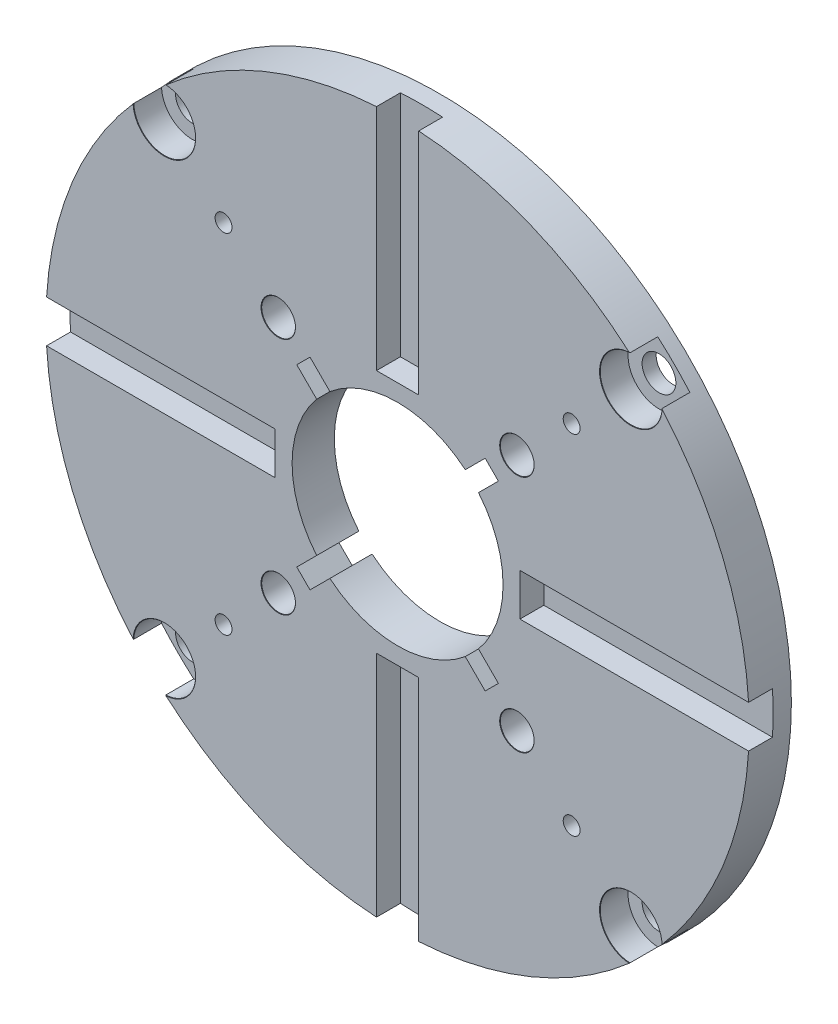
from build123d import *

# Parameters (mm, degrees)
SKETCH1_R             = 0.6
BOSS_EXTRUDE1_DEPTH   = 3
BOSS_EXTRUDE1_2_DEPTH = 3
BOSS_EXTRUDE1_3_DEPTH = 3
BOSS_EXTRUDE1_4_DEPTH = 3
BOSS_EXTRUDE2_DEPTH   = 1.3
BOSS_EXTRUDE3_DEPTH   = 3
CIRPATTERN1_COUNT     = 4


# Read off the part's stored shape, not the designer's step: M2 Clearance Hole1
with BuildPart() as part:
    # Sketch1 → Boss-Extrude1 (new body)
    with BuildSketch(Plane(origin=(0, 0, 0), x_dir=(0, 1, 0), z_dir=(0, 0, 1))):
        with BuildLine():
            Line((-1.5, 7.348469228), (-1.5, 24.954959427))
            ThreePointArc((-1.5, 24.954959427), (-17.67766953, 17.67766953), (-24.954959427, 1.5))
            Line((-24.954959427, 1.5), (-7.348469228, 1.5))
            ThreePointArc((-7.348469228, 1.5), (-6.756656365, 3.255394717), (-5.752639047, 4.812187028))
            Line((-5.752639047, 4.812187028), (-7.166852609, 6.226400591))
            Line((-7.166852609, 6.226400591), (-6.226400591, 7.166852609))
            Line((-6.226400591, 7.166852609), (-4.812187028, 5.752639047))
            ThreePointArc((-4.812187028, 5.752639047), (-3.255394717, 6.756656365), (-1.5, 7.348469228))
        make_face()
        with Locations(Location((-12.375, 12.375, 0), (0, 0, 270))):
            Circle(SKETCH1_R, mode=Mode.SUBTRACT)
    extrude(amount=BOSS_EXTRUDE1_DEPTH)

    # Sketch1<9> → Boss-Extrude2 (add)
    with BuildSketch(Plane(origin=(0, 0, 0), x_dir=(0, 1, 0), z_dir=(0, 0, 1))):
        with BuildLine():
            Line((1.5, 7.348469228), (1.5, 24.954959427))
            ThreePointArc((1.5, 24.954959427), (0, 25), (-1.5, 24.954959427))
            Line((-1.5, 24.954959427), (-1.5, 7.348469228))
            ThreePointArc((-1.5, 7.348469228), (0, 7.5), (1.5, 7.348469228))
        make_face()
        with BuildLine():
            ThreePointArc((-24.954959427, 1.5), (-25, 0), (-24.954959427, -1.5))
            Line((-24.954959427, -1.5), (-7.348469228, -1.5))
            ThreePointArc((-7.348469228, -1.5), (-7.5, 0), (-7.348469228, 1.5))
            Line((-7.348469228, 1.5), (-24.954959427, 1.5))
        make_face()
        with BuildLine():
            ThreePointArc((24.954959427, -1.5), (25, 0), (24.954959427, 1.5))
            Line((24.954959427, 1.5), (7.348469228, 1.5))
            ThreePointArc((7.348469228, 1.5), (7.5, 0), (7.348469228, -1.5))
            Line((7.348469228, -1.5), (24.954959427, -1.5))
        make_face()
        with BuildLine():
            ThreePointArc((-1.5, -24.954959427), (0, -25), (1.5, -24.954959427))
            Line((1.5, -24.954959427), (1.5, -7.348469228))
            ThreePointArc((1.5, -7.348469228), (0, -7.5), (-1.5, -7.348469228))
            Line((-1.5, -7.348469228), (-1.5, -24.954959427))
        make_face()
    extrude(amount=BOSS_EXTRUDE2_DEPTH)


with BuildPart() as body_2:
    # Sketch1 → Boss-Extrude1 2 (new body)
    with BuildSketch(Plane(origin=(0, 0, 0), x_dir=(0, 1, 0), z_dir=(0, 0, 1))):
        with BuildLine():
            Line((1.5, 24.954959427), (1.5, 7.348469228))
            ThreePointArc((1.5, 7.348469228), (3.255394717, 6.756656365), (4.812187028, 5.752639047))
            Line((4.812187028, 5.752639047), (6.226400591, 7.166852609))
            Line((6.226400591, 7.166852609), (7.166852609, 6.226400591))
            Line((7.166852609, 6.226400591), (5.752639047, 4.812187028))
            ThreePointArc((5.752639047, 4.812187028), (6.756656365, 3.255394717), (7.348469228, 1.5))
            Line((7.348469228, 1.5), (24.954959427, 1.5))
            ThreePointArc((24.954959427, 1.5), (17.67766953, 17.67766953), (1.5, 24.954959427))
        make_face()
        with Locations(Location((12.375, 12.375, 0), (0, 0, 270))):
            Circle(SKETCH1_R, mode=Mode.SUBTRACT)
    extrude(amount=BOSS_EXTRUDE1_2_DEPTH)

    # M2 Clearance Hole1 4 outline → M2 Clearance Hole1 4 (revolve, cut)
    with BuildSketch(Plane(origin=(-8.485, 8.485, 0), x_dir=(1, 0, 0), z_dir=(0, -1, 0))):
        Polygon((0, 0), (1.2, 0), (1.2, 2.975), (1.225, 3), (0, 3), align=None)
    revolve(axis=Axis((-8.485, 8.485, 0), (0, 0, 1)), mode=Mode.SUBTRACT)



with BuildPart() as body_3:
    # Sketch1 → Boss-Extrude1 3 (new body)
    with BuildSketch(Plane(origin=(0, 0, 0), x_dir=(0, 1, 0), z_dir=(0, 0, 1))):
        with BuildLine():
            Line((-7.348469228, -1.5), (-24.954959427, -1.5))
            ThreePointArc((-24.954959427, -1.5), (-17.67766953, -17.67766953), (-1.5, -24.954959427))
            Line((-1.5, -24.954959427), (-1.5, -7.348469228))
            ThreePointArc((-1.5, -7.348469228), (-3.255394717, -6.756656365), (-4.812187028, -5.752639047))
            Line((-4.812187028, -5.752639047), (-6.226400591, -7.166852609))
            Line((-6.226400591, -7.166852609), (-7.166852609, -6.226400591))
            Line((-7.166852609, -6.226400591), (-5.752639047, -4.812187028))
            ThreePointArc((-5.752639047, -4.812187028), (-6.756656365, -3.255394717), (-7.348469228, -1.5))
        make_face()
        with Locations(Location((-12.375, -12.375, 0), (0, 0, 270))):
            Circle(SKETCH1_R, mode=Mode.SUBTRACT)
    extrude(amount=BOSS_EXTRUDE1_3_DEPTH)

    # M2 Clearance Hole1 2 outline → M2 Clearance Hole1 2 (revolve, cut)
    with BuildSketch(Plane(origin=(8.485, -8.485, 0), x_dir=(1, 0, 0), z_dir=(0, -1, 0))):
        Polygon((0, 0), (1.2, 0), (1.2, 2.975), (1.225, 3), (0, 3), align=None)
    revolve(axis=Axis((8.485, -8.485, 0), (0, 0, 1)), mode=Mode.SUBTRACT)


with BuildPart() as body_4:
    # Sketch1 → Boss-Extrude1 4 (new body)
    with BuildSketch(Plane(origin=(0, 0, 0), x_dir=(0, 1, 0), z_dir=(0, 0, 1))):
        with BuildLine():
            Line((24.954959427, -1.5), (7.348469228, -1.5))
            ThreePointArc((7.348469228, -1.5), (6.756656365, -3.255394717), (5.752639047, -4.812187028))
            Line((5.752639047, -4.812187028), (7.166852609, -6.226400591))
            Line((7.166852609, -6.226400591), (6.226400591, -7.166852609))
            Line((6.226400591, -7.166852609), (4.812187028, -5.752639047))
            ThreePointArc((4.812187028, -5.752639047), (3.255394717, -6.756656365), (1.5, -7.348469228))
            Line((1.5, -7.348469228), (1.5, -24.954959427))
            ThreePointArc((1.5, -24.954959427), (17.67766953, -17.67766953), (24.954959427, -1.5))
        make_face()
        with Locations(Location((12.375, -12.375, 0), (0, 0, 270))):
            Circle(SKETCH1_R, mode=Mode.SUBTRACT)
    extrude(amount=BOSS_EXTRUDE1_4_DEPTH)

    # M2 Clearance Hole1 outline → M2 Clearance Hole1 (revolve, cut)
    with BuildSketch(Plane(origin=(8.485, 8.485, 0), x_dir=(1, 0, 0), z_dir=(0, -1, 0))):
        Polygon((0, 0), (1.2, 0), (1.2, 2.975), (1.225, 3), (0, 3), align=None)
    revolve(axis=Axis((8.485, 8.485, 0), (0, 0, 1)), mode=Mode.SUBTRACT)


with BuildPart() as boss_extrude2_piece_1:
    # of the separate pieces the step leaves, piece 1, a body of its own (boss_extrude2_pieces)
    add(part.part.solids().sort_by_distance((-24.954959427, -1.5, 1.3))[0])

    # M2 Clearance Hole1 3 outline → M2 Clearance Hole1 3 (revolve, cut)
    with BuildSketch(Plane(origin=(-8.485, -8.485, 0), x_dir=(1, 0, 0), z_dir=(0, -1, 0))):
        Polygon((0, 0), (1.2, 0), (1.2, 2.975), (1.225, 3), (0, 3), align=None)
    revolve(axis=Axis((-8.485, -8.485, 0), (0, 0, 1)), mode=Mode.SUBTRACT)


with BuildPart() as boss_extrude2_piece_2:
    # of the separate pieces the step leaves, piece 2, a body of its own (boss_extrude2_pieces)
    add(part.part.solids().sort_by_distance((-1.5, 7.348469228, 0))[0])


with BuildPart() as boss_extrude2_piece_3:
    # of the separate pieces the step leaves, piece 3, a body of its own (boss_extrude2_pieces)
    add(part.part.solids().sort_by_distance((24.954959427, -1.5, 0))[0])


with BuildPart() as body_2_1:
    add(body_2.part)

    add(body_3.part)  # Boss-Extrude3 merges body 3

    add(body_4.part)  # Boss-Extrude3 merges body 4

    add(boss_extrude2_piece_1.part)  # Boss-Extrude3 merges Boss-Extrude2 piece 1

    add(boss_extrude2_piece_2.part)  # Boss-Extrude3 merges Boss-Extrude2 piece 2

    add(boss_extrude2_piece_3.part)  # Boss-Extrude3 merges Boss-Extrude2 piece 3
    # Sketch1<10> → Boss-Extrude3 (add)
    with BuildSketch(Plane(origin=(0, 0, 0), x_dir=(0, 1, 0), z_dir=(0, 0, 1))):
        with BuildLine():
            Line((-1.5, -7.348469228), (-1.5, -8.7))
            Line((-1.5, -8.7), (1.5, -8.7))
            Line((1.5, -8.7), (1.5, -7.348469228))
            ThreePointArc((1.5, -7.348469228), (0, -7.5), (-1.5, -7.348469228))
        make_face()
        with BuildLine():
            Line((-7.348469228, 1.5), (-8.7, 1.5))
            Line((-8.7, 1.5), (-8.7, -1.5))
            Line((-8.7, -1.5), (-7.348469228, -1.5))
            ThreePointArc((-7.348469228, -1.5), (-7.5, 0), (-7.348469228, 1.5))
        make_face()
        with BuildLine():
            Line((1.5, 8.7), (-1.5, 8.7))
            Line((-1.5, 8.7), (-1.5, 7.348469228))
            ThreePointArc((-1.5, 7.348469228), (0, 7.5), (1.5, 7.348469228))
            Line((1.5, 7.348469228), (1.5, 8.7))
        make_face()
        with BuildLine():
            Line((8.7, -1.5), (8.7, 1.5))
            Line((8.7, 1.5), (7.348469228, 1.5))
            ThreePointArc((7.348469228, 1.5), (7.5, 0), (7.348469228, -1.5))
            Line((7.348469228, -1.5), (8.7, -1.5))
        make_face()
    extrude(amount=BOSS_EXTRUDE3_DEPTH)

    # Sketch8 → CBORE for M2 SHCS1 (revolve, cut)
    with BuildSketch(Plane(origin=(16.584366049, 16.584366049, 3), x_dir=(0, -1, 0), z_dir=(1, 0, 0))):
        Polygon((0, 0), (0, 3), (1.2, 3), (1.2, 2), (2.2, 2), (2.2, 0.025), (2.225, 0), align=None)
    cbore_for_m2_shcs1 = revolve(axis=Axis((16.584366049, 16.584366049, 9.35), (0, 0, -1)), mode=Mode.SUBTRACT)

    # CirPattern1: CBORE for M2 SHCS1 ×4 about axis
    cirpattern1_axis = Axis((0, 0, 0), (0, 0, 1))
    for i in range(1, CIRPATTERN1_COUNT):
        add(cbore_for_m2_shcs1.rotate(cirpattern1_axis, i * 360 / CIRPATTERN1_COUNT), mode=Mode.SUBTRACT)


solid = body_2_1.part
